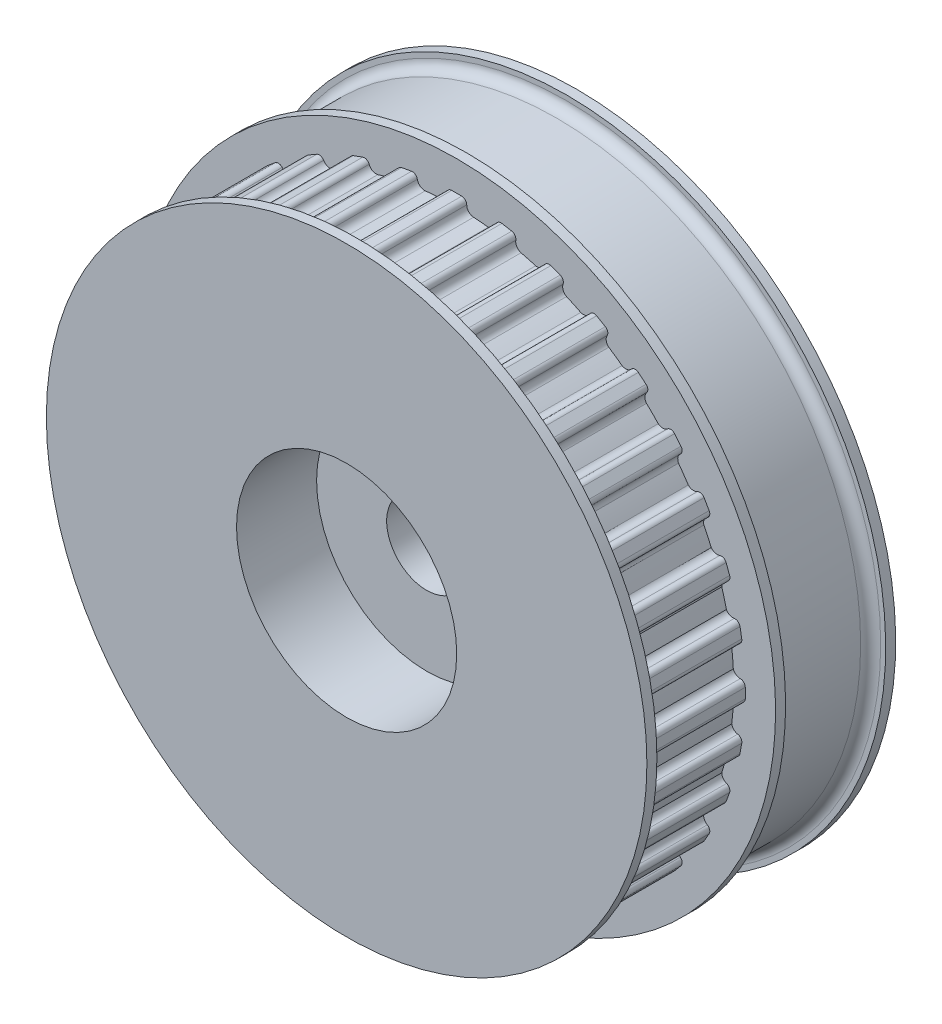
from build123d import *

# Parameters (mm, degrees)
ESQUISSE1_R                  = 27.675
BOSS_EXTRU_2_DEPTH           = 10
BOSS_EXTRU_3_DEPTH           = 10
R_P_TITION_CIRCULAIRE1_DEPTH = 10
CONG_1_R                     = 1
ESQUISSE6_R                  = 30
BOSS_EXTRU_4_DEPTH           = 1
ESQUISSE7_R                  = 11
ENL_V_MAT_EXTRU_1_DEPTH      = 8
ENL_V_START                  = -8
ESQUISSE8_R                  = 11
ENL_V_MAT_EXTRU_2_DEPTH      = 8
ESQUISSE9_R                  = 4
ENL_V_MAT_EXTRU_3_DEPTH      = 7


# Read off the part's stored shape, not the designer's step: Répétition circulaire1
with BuildPart() as part:
    # Esquisse1 → Boss.-Extru.2 (new body)
    with BuildSketch(Plane.XY):
        Circle(ESQUISSE1_R)
    extrude(amount=BOSS_EXTRU_2_DEPTH)

    # Esquisse1<6> → Boss.-Extru.3 (add)
    with BuildSketch(Plane.XY):
        with BuildLine():
            Line((0.5, 28.857678787), (-0.5, 28.857678787))
            ThreePointArc((-0.5, 28.857678787), (-0.853553391, 28.711232178), (-1, 28.357678787))
            ThreePointArc((-1, 28.357678787), (-1.203003238, 27.850200032), (-1.7, 27.622737464))
            ThreePointArc((-1.7, 27.622737464), (-18.958614467, -20.161263911), (27.675, 0))
            ThreePointArc((27.675, 0), (20.161263911, 18.958614467), (1.7, 27.622737464))
            ThreePointArc((1.7, 27.622737464), (1.203003238, 27.850200032), (1, 28.357678787))
            ThreePointArc((1, 28.357678787), (0.853553391, 28.711232178), (0.5, 28.857678787))
        make_face()
    extrude(amount=BOSS_EXTRU_3_DEPTH)

    # Répétition circulaire1 outline → Répétition circulaire1 (add)
    with BuildSketch(Plane.XY):
        with BuildLine():
            ThreePointArc((-6.424144978, 26.919063622), (-4.79229686, 27.256916843), (-3.143072504, 27.495940068))
            ThreePointArc((-3.143072504, 27.495940068), (-3.656689975, 27.644175319), (-3.934418407, 28.100950443))
            ThreePointArc((-3.934418407, 28.100950443), (-4.140034065, 28.423702376), (-4.513646372, 28.506530231))
            Line((-4.513646372, 28.506530231), (-5.498454125, 28.332882053))
            ThreePointArc((-5.498454125, 28.332882053), (-5.821206058, 28.127266395), (-5.904033913, 27.753654088))
            ThreePointArc((-5.904033913, 27.753654088), (-6.00419355, 27.236712828), (-6.424144978, 26.919063622))
        make_face()
        with BuildLine():
            ThreePointArc((3.143072504, 27.495940068), (4.79229686, 27.256916843), (6.424144978, 26.919063622))
            ThreePointArc((6.424144978, 26.919063622), (6.00419355, 27.236712828), (5.904033913, 27.753654088))
            ThreePointArc((5.904033913, 27.753654088), (5.821206058, 28.127266395), (5.498454125, 28.332882053))
            Line((5.498454125, 28.332882053), (4.513646372, 28.506530231))
            ThreePointArc((4.513646372, 28.506530231), (4.140034065, 28.423702376), (3.934418407, 28.100950443))
            ThreePointArc((3.934418407, 28.100950443), (3.656689975, 27.644175319), (3.143072504, 27.495940068))
        make_face()
        with BuildLine():
            ThreePointArc((7.889170476, 26.526715104), (9.448214121, 26.012244711), (10.974008576, 25.406234683))
            ThreePointArc((10.974008576, 25.406234683), (10.633039658, 25.792225092), (10.628676742, 26.307229328))
            ThreePointArc((10.628676742, 26.307229328), (10.611984326, 26.68954853), (10.329840504, 26.94808571))
            Line((10.329840504, 26.94808571), (9.390147883, 27.290105853))
            ThreePointArc((9.390147883, 27.290105853), (9.00782868, 27.273413436), (8.749291501, 26.991269614))
            ThreePointArc((8.749291501, 26.991269614), (8.407525978, 26.5955145), (7.889170476, 26.526715104))
        make_face()
        with BuildLine():
            ThreePointArc((12.393552552, 24.744807135), (13.817948437, 23.978530522), (15.195146723, 23.130351079))
            ThreePointArc((15.195146723, 23.130351079), (14.943029133, 23.566344587), (15.030372608, 24.062353393))
            ThreePointArc((15.030372608, 24.062353393), (15.080322819, 24.441762916), (14.847359906, 24.745366095))
            Line((14.847359906, 24.745366095), (13.981334502, 25.245366095))
            ThreePointArc((13.981334502, 25.245366095), (13.601924979, 25.295316306), (13.2983218, 25.062353393))
            ThreePointArc((13.2983218, 25.062353393), (12.904764441, 24.735966573), (12.393552552, 24.744807135))
        make_face()
        with BuildLine():
            ThreePointArc((16.518114838, 22.20489827), (17.7689566, 21.217205432), (18.960867241, 20.159145281))
            ThreePointArc((18.960867241, 20.159145281), (18.803320498, 20.625767223), (18.975378207, 21.087235702))
            ThreePointArc((18.975378207, 21.087235702), (19.090453335, 21.452207378), (18.91374979, 21.791651728))
            Line((18.91374979, 21.791651728), (18.147705347, 22.434439338))
            ThreePointArc((18.147705347, 22.434439338), (17.782733671, 22.549514465), (17.443289321, 22.372810921))
            ThreePointArc((17.443289321, 22.372810921), (17.01102193, 22.121796592), (16.518114838, 22.20489827))
        make_face()
        with BuildLine():
            ThreePointArc((20.136490878, 18.984924549), (21.18130249, 17.811739102), (22.157861101, 16.581158477))
            ThreePointArc((22.157861101, 16.581158477), (22.096502482, 17.058925341), (22.343826542, 17.4722737))
            ThreePointArc((22.343826542, 17.4722737), (22.520530086, 17.811718051), (22.405454958, 18.176689727))
            Line((22.405454958, 18.176689727), (21.762667349, 18.94273417))
            ThreePointArc((21.762667349, 18.94273417), (21.423222999, 19.119437714), (21.058251322, 19.004362587))
            ThreePointArc((21.058251322, 19.004362587), (20.600792937, 18.832378509), (20.136490878, 18.984924549))
        make_face()
        with BuildLine():
            ThreePointArc((23.137882669, 15.183675793), (23.951264035, 13.865156909), (24.689590487, 12.503189456))
            ThreePointArc((24.689590487, 12.503189456), (24.722179419, 12.973356653), (25.033369013, 13.32730618))
            ThreePointArc((25.033369013, 13.32730618), (25.266331926, 13.630909359), (25.216381715, 14.010318882))
            Line((25.216381715, 14.010318882), (24.716381715, 14.876344285))
            ThreePointArc((24.716381715, 14.876344285), (24.412778536, 15.109307199), (24.033369013, 15.059356987))
            ThreePointArc((24.033369013, 15.059356987), (23.564281023, 14.967766578), (23.137882669, 15.183675793))
        make_face()
        with BuildLine():
            ThreePointArc((25.430460102, 10.917752698), (25.99448608, 9.496963643), (26.479203261, 8.047199491))
            ThreePointArc((26.479203261, 8.047199491), (26.600052198, 8.492488796), (26.962285235, 8.77827588))
            ThreePointArc((26.962285235, 8.77827588), (27.244429057, 9.03681306), (27.261121474, 9.419132262))
            Line((27.261121474, 9.419132262), (26.91910133, 10.358824883))
            ThreePointArc((26.91910133, 10.358824883), (26.660564151, 10.640968705), (26.278244948, 10.657661122))
            ThreePointArc((26.278244948, 10.657661122), (25.810769805, 10.645646292), (25.430460102, 10.917752698))
        make_face()
        with BuildLine():
            ThreePointArc((26.944179758, 6.317974529), (27.248564404, 4.839562267), (27.471892269, 3.346753675))
            ThreePointArc((27.471892269, 3.346753675), (27.672401023, 3.751931091), (28.071966063, 3.963402786))
            ThreePointArc((28.071966063, 3.963402786), (28.394717997, 4.169018444), (28.477545851, 4.542630751))
            Line((28.477545851, 4.542630751), (28.303897673, 5.527438504))
            ThreePointArc((28.303897673, 5.527438504), (28.098282015, 5.850190438), (27.724669708, 5.933018292))
            ThreePointArc((27.724669708, 5.933018292), (27.271413498, 5.997742575), (26.944179758, 6.317974529))
        make_face()
        with BuildLine():
            ThreePointArc((27.632932139, 1.525347958), (27.674978781, 0.034270741), (27.636625152, -1.456906038))
            ThreePointArc((27.636625152, -1.456906038), (27.905891454, -1.104617248), (28.328694408, -0.971015621))
            ThreePointArc((28.328694408, -0.971015621), (28.682247799, -0.824569011), (28.828694408, -0.471015621))
            Line((28.828694408, -0.471015621), (28.828694408, 0.528984379))
            ThreePointArc((28.828694408, 0.528984379), (28.682247799, 0.88253777), (28.328694408, 1.028984379))
            ThreePointArc((28.328694408, 1.028984379), (27.901359078, 1.165793712), (27.632932139, 1.525347958))
        make_face()
        with BuildLine():
            ThreePointArc((27.475949667, -3.313278569), (27.260311872, -4.772946853), (26.967185059, -6.219047758))
            ThreePointArc((26.967185059, -6.219047758), (27.29264474, -5.929720179), (27.724669708, -5.875049533))
            ThreePointArc((27.724669708, -5.875049533), (28.098282015, -5.792221679), (28.303897673, -5.469469745))
            Line((28.303897673, -5.469469745), (28.477545851, -4.484661992))
            ThreePointArc((28.477545851, -4.484661992), (28.394717997, -4.111049685), (28.071966063, -3.905434027))
            ThreePointArc((28.071966063, -3.905434027), (27.681133515, -3.702785876), (27.475949667, -3.313278569))
        make_face()
        with BuildLine():
            ThreePointArc((26.478430923, -8.049740423), (26.016711192, -9.43590821), (25.482480602, -10.795777292))
            ThreePointArc((25.482480602, -10.795777292), (25.850535444, -10.576687654), (26.278244948, -10.599692363))
            ThreePointArc((26.278244948, -10.599692363), (26.660564151, -10.582999946), (26.91910133, -10.300856124))
            Line((26.91910133, -10.300856124), (27.261121474, -9.361163503))
            ThreePointArc((27.261121474, -9.361163503), (27.244429057, -8.978844301), (26.962285235, -8.720307121))
            ThreePointArc((26.962285235, -8.720307121), (26.617252193, -8.459420887), (26.478430923, -8.049740423))
        make_face()
        with BuildLine():
            ThreePointArc((24.671360923, -12.539121787), (23.981573714, -13.812666187), (23.22610391, -15.048379386))
            ThreePointArc((23.22610391, -15.048379386), (23.622702769, -14.904051397), (24.033369013, -15.001388228))
            ThreePointArc((24.033369013, -15.001388228), (24.412778536, -15.05133844), (24.716381715, -14.818375526))
            Line((24.716381715, -14.818375526), (25.216381715, -13.952350123))
            ThreePointArc((25.216381715, -13.952350123), (25.266331926, -13.5729406), (25.033369013, -13.269337421))
            ThreePointArc((25.033369013, -13.269337421), (24.742028624, -12.958929404), (24.671360923, -12.539121787))
        make_face()
        with BuildLine():
            ThreePointArc((22.11053237, -16.644217714), (21.216456316, -17.769851052), (20.265138012, -18.847541122))
            ThreePointArc((20.265138012, -18.847541122), (20.676286339, -18.779895826), (21.058251322, -18.946393828))
            ThreePointArc((21.058251322, -18.946393828), (21.423222999, -19.061468955), (21.762667349, -18.884765411))
            Line((21.762667349, -18.884765411), (22.405454958, -18.118720968))
            ThreePointArc((22.405454958, -18.118720968), (22.520530086, -17.753749292), (22.343826542, -17.414304941))
            ThreePointArc((22.343826542, -17.414304941), (22.112590254, -17.063975568), (22.11053237, -16.644217714))
        make_face()
        with BuildLine():
            ThreePointArc((18.874797938, -20.23975365), (17.805239611, -21.186766327), (16.688238468, -22.077325967))
            ThreePointArc((16.688238468, -22.077325967), (17.100421454, -22.085909599), (17.443289321, -22.314842162))
            ThreePointArc((17.443289321, -22.314842162), (17.782733671, -22.491545706), (18.147705347, -22.376470579))
            Line((18.147705347, -22.376470579), (18.91374979, -21.733682969))
            ThreePointArc((18.91374979, -21.733682969), (19.090453335, -21.394238619), (18.975378207, -21.029266943))
            ThreePointArc((18.975378207, -21.029266943), (18.809129828, -20.64928283), (18.874797938, -20.23975365))
        make_face()
        with BuildLine():
            ThreePointArc((15.063608203, -23.216229946), (13.851596836, -23.959108708), (12.603038059, -24.638771412))
            ThreePointArc((12.603038059, -24.638771412), (13.003552331, -24.721031), (13.2983218, -25.004384634))
            ThreePointArc((13.2983218, -25.004384634), (13.601924979, -25.237347547), (13.981334502, -25.187397336))
            Line((13.981334502, -25.187397336), (14.847359906, -24.687397336))
            ThreePointArc((14.847359906, -24.687397336), (15.080322819, -24.383794157), (15.030372608, -24.004384634))
            ThreePointArc((15.030372608, -24.004384634), (14.932445651, -23.605477067), (15.063608203, -23.216229946))
        make_face()
        with BuildLine():
            ThreePointArc((10.793912773, -25.483270435), (9.475842554, -26.002192848), (8.132946656, -26.452992339))
            ThreePointArc((8.132946656, -26.452992339), (8.510143799, -26.604572214), (8.749291501, -26.933300855))
            ThreePointArc((8.749291501, -26.933300855), (9.00782868, -27.215444677), (9.390147883, -27.232137094))
            Line((9.390147883, -27.232137094), (10.329840504, -26.890116951))
            ThreePointArc((10.329840504, -26.890116951), (10.611984326, -26.631579771), (10.628676742, -26.249260569))
            ThreePointArc((10.628676742, -26.249260569), (10.600846431, -25.842440074), (10.793912773, -25.483270435))
        make_face()
        with BuildLine():
            ThreePointArc((6.196522889, -26.972369734), (4.811256994, -27.253576483), (3.413439842, -27.463686086))
            ThreePointArc((3.413439842, -27.463686086), (3.756891384, -27.678723342), (3.934418407, -28.042981684))
            ThreePointArc((3.934418407, -28.042981684), (4.140034065, -28.365733617), (4.513646372, -28.448561472))
            Line((4.513646372, -28.448561472), (5.498454125, -28.274913294))
            ThreePointArc((5.498454125, -28.274913294), (5.821206058, -28.069297636), (5.904033913, -27.695685329))
            ThreePointArc((5.904033913, -27.695685329), (5.946516436, -27.29206904), (6.196522889, -26.972369734))
        make_face()
        with BuildLine():
            ThreePointArc((1.412051437, -27.638953232), (0, -27.675), (-1.412051437, -27.638953232))
            ThreePointArc((-1.412051437, -27.638953232), (-1.111453828, -27.910356098), (-1, -28.299710028))
            ThreePointArc((-1, -28.299710028), (-0.853553391, -28.653263419), (-0.5, -28.799710028))
            Line((-0.5, -28.799710028), (0.5, -28.799710028))
            ThreePointArc((0.5, -28.799710028), (0.853553391, -28.653263419), (1, -28.299710028))
            ThreePointArc((1, -28.299710028), (1.111453828, -27.910356098), (1.412051437, -27.638953232))
        make_face()
        with BuildLine():
            ThreePointArc((-3.413439842, -27.463686086), (-4.811256994, -27.253576483), (-6.196522889, -26.972369734))
            ThreePointArc((-6.196522889, -26.972369734), (-5.946516436, -27.29206904), (-5.904033913, -27.695685329))
            ThreePointArc((-5.904033913, -27.695685329), (-5.821206058, -28.069297636), (-5.498454125, -28.274913294))
            Line((-5.498454125, -28.274913294), (-4.513646372, -28.448561472))
            ThreePointArc((-4.513646372, -28.448561472), (-4.140034065, -28.365733617), (-3.934418407, -28.042981684))
            ThreePointArc((-3.934418407, -28.042981684), (-3.756891384, -27.678723342), (-3.413439842, -27.463686086))
        make_face()
        with BuildLine():
            ThreePointArc((-8.132946656, -26.452992339), (-9.475842554, -26.002192848), (-10.793912773, -25.483270435))
            ThreePointArc((-10.793912773, -25.483270435), (-10.600846431, -25.842440074), (-10.628676742, -26.249260569))
            ThreePointArc((-10.628676742, -26.249260569), (-10.611984326, -26.631579771), (-10.329840504, -26.890116951))
            Line((-10.329840504, -26.890116951), (-9.390147883, -27.232137094))
            ThreePointArc((-9.390147883, -27.232137094), (-9.00782868, -27.215444677), (-8.749291501, -26.933300855))
            ThreePointArc((-8.749291501, -26.933300855), (-8.510143799, -26.604572214), (-8.132946656, -26.452992339))
        make_face()
        with BuildLine():
            ThreePointArc((-12.603038059, -24.638771412), (-13.851596836, -23.959108708), (-15.063608203, -23.216229946))
            ThreePointArc((-15.063608203, -23.216229946), (-14.932445651, -23.605477067), (-15.030372608, -24.004384634))
            ThreePointArc((-15.030372608, -24.004384634), (-15.080322819, -24.383794157), (-14.847359906, -24.687397336))
            Line((-14.847359906, -24.687397336), (-13.981334502, -25.187397336))
            ThreePointArc((-13.981334502, -25.187397336), (-13.601924979, -25.237347547), (-13.2983218, -25.004384634))
            ThreePointArc((-13.2983218, -25.004384634), (-13.003552331, -24.721031), (-12.603038059, -24.638771412))
        make_face()
        with BuildLine():
            ThreePointArc((-16.688238468, -22.077325967), (-17.805239611, -21.186766327), (-18.874797938, -20.23975365))
            ThreePointArc((-18.874797938, -20.23975365), (-18.809129828, -20.64928283), (-18.975378207, -21.029266943))
            ThreePointArc((-18.975378207, -21.029266943), (-19.090453335, -21.394238619), (-18.91374979, -21.733682969))
            Line((-18.91374979, -21.733682969), (-18.147705347, -22.376470579))
            ThreePointArc((-18.147705347, -22.376470579), (-17.782733671, -22.491545706), (-17.443289321, -22.314842162))
            ThreePointArc((-17.443289321, -22.314842162), (-17.100421454, -22.085909599), (-16.688238468, -22.077325967))
        make_face()
        with BuildLine():
            ThreePointArc((-20.265138012, -18.847541122), (-21.216456316, -17.769851052), (-22.11053237, -16.644217714))
            ThreePointArc((-22.11053237, -16.644217714), (-22.112590254, -17.063975568), (-22.343826542, -17.414304941))
            ThreePointArc((-22.343826542, -17.414304941), (-22.520530086, -17.753749292), (-22.405454958, -18.118720968))
            Line((-22.405454958, -18.118720968), (-21.762667349, -18.884765411))
            ThreePointArc((-21.762667349, -18.884765411), (-21.423222999, -19.061468955), (-21.058251322, -18.946393828))
            ThreePointArc((-21.058251322, -18.946393828), (-20.676286339, -18.779895826), (-20.265138012, -18.847541122))
        make_face()
        with BuildLine():
            ThreePointArc((-23.22610391, -15.048379386), (-23.981573714, -13.812666187), (-24.671360923, -12.539121787))
            ThreePointArc((-24.671360923, -12.539121787), (-24.742028624, -12.958929404), (-25.033369013, -13.269337421))
            ThreePointArc((-25.033369013, -13.269337421), (-25.266331926, -13.5729406), (-25.216381715, -13.952350123))
            Line((-25.216381715, -13.952350123), (-24.716381715, -14.818375526))
            ThreePointArc((-24.716381715, -14.818375526), (-24.412778536, -15.05133844), (-24.033369013, -15.001388228))
            ThreePointArc((-24.033369013, -15.001388228), (-23.622702769, -14.904051397), (-23.22610391, -15.048379386))
        make_face()
        with BuildLine():
            ThreePointArc((-25.482480602, -10.795777292), (-26.016711192, -9.43590821), (-26.478430923, -8.049740423))
            ThreePointArc((-26.478430923, -8.049740423), (-26.617252193, -8.459420887), (-26.962285235, -8.720307121))
            ThreePointArc((-26.962285235, -8.720307121), (-27.244429057, -8.978844301), (-27.261121474, -9.361163503))
            Line((-27.261121474, -9.361163503), (-26.91910133, -10.300856124))
            ThreePointArc((-26.91910133, -10.300856124), (-26.660564151, -10.582999946), (-26.278244948, -10.599692363))
            ThreePointArc((-26.278244948, -10.599692363), (-25.850535444, -10.576687654), (-25.482480602, -10.795777292))
        make_face()
        with BuildLine():
            ThreePointArc((-26.967185059, -6.219047758), (-27.260311872, -4.772946853), (-27.475949667, -3.313278569))
            ThreePointArc((-27.475949667, -3.313278569), (-27.681133515, -3.702785876), (-28.071966063, -3.905434027))
            ThreePointArc((-28.071966063, -3.905434027), (-28.394717997, -4.111049685), (-28.477545851, -4.484661992))
            Line((-28.477545851, -4.484661992), (-28.303897673, -5.469469745))
            ThreePointArc((-28.303897673, -5.469469745), (-28.098282015, -5.792221679), (-27.724669708, -5.875049533))
            ThreePointArc((-27.724669708, -5.875049533), (-27.29264474, -5.929720179), (-26.967185059, -6.219047758))
        make_face()
        with BuildLine():
            ThreePointArc((-27.636625152, -1.456906038), (-27.674978781, 0.034270741), (-27.632932139, 1.525347958))
            ThreePointArc((-27.632932139, 1.525347958), (-27.901359078, 1.165793712), (-28.328694408, 1.028984379))
            ThreePointArc((-28.328694408, 1.028984379), (-28.682247799, 0.88253777), (-28.828694408, 0.528984379))
            Line((-28.828694408, 0.528984379), (-28.828694408, -0.471015621))
            ThreePointArc((-28.828694408, -0.471015621), (-28.682247799, -0.824569011), (-28.328694408, -0.971015621))
            ThreePointArc((-28.328694408, -0.971015621), (-27.905891454, -1.104617248), (-27.636625152, -1.456906038))
        make_face()
        with BuildLine():
            ThreePointArc((-27.471892269, 3.346753675), (-27.248564404, 4.839562267), (-26.944179758, 6.317974529))
            ThreePointArc((-26.944179758, 6.317974529), (-27.271413498, 5.997742575), (-27.724669708, 5.933018292))
            ThreePointArc((-27.724669708, 5.933018292), (-28.098282015, 5.850190438), (-28.303897673, 5.527438504))
            Line((-28.303897673, 5.527438504), (-28.477545851, 4.542630751))
            ThreePointArc((-28.477545851, 4.542630751), (-28.394717997, 4.169018444), (-28.071966063, 3.963402786))
            ThreePointArc((-28.071966063, 3.963402786), (-27.672401023, 3.751931091), (-27.471892269, 3.346753675))
        make_face()
        with BuildLine():
            ThreePointArc((-26.479203261, 8.047199491), (-25.99448608, 9.496963643), (-25.430460102, 10.917752698))
            ThreePointArc((-25.430460102, 10.917752698), (-25.810769805, 10.645646292), (-26.278244948, 10.657661122))
            ThreePointArc((-26.278244948, 10.657661122), (-26.660564151, 10.640968705), (-26.91910133, 10.358824883))
            Line((-26.91910133, 10.358824883), (-27.261121474, 9.419132262))
            ThreePointArc((-27.261121474, 9.419132262), (-27.244429057, 9.03681306), (-26.962285235, 8.77827588))
            ThreePointArc((-26.962285235, 8.77827588), (-26.600052198, 8.492488796), (-26.479203261, 8.047199491))
        make_face()
        with BuildLine():
            ThreePointArc((-24.689590487, 12.503189456), (-23.951264035, 13.865156909), (-23.137882669, 15.183675793))
            ThreePointArc((-23.137882669, 15.183675793), (-23.564281023, 14.967766578), (-24.033369013, 15.059356987))
            ThreePointArc((-24.033369013, 15.059356987), (-24.412778536, 15.109307199), (-24.716381715, 14.876344285))
            Line((-24.716381715, 14.876344285), (-25.216381715, 14.010318882))
            ThreePointArc((-25.216381715, 14.010318882), (-25.266331926, 13.630909359), (-25.033369013, 13.32730618))
            ThreePointArc((-25.033369013, 13.32730618), (-24.722179419, 12.973356653), (-24.689590487, 12.503189456))
        make_face()
        with BuildLine():
            ThreePointArc((-22.157861101, 16.581158477), (-21.18130249, 17.811739102), (-20.136490878, 18.984924549))
            ThreePointArc((-20.136490878, 18.984924549), (-20.600792937, 18.832378509), (-21.058251322, 19.004362587))
            ThreePointArc((-21.058251322, 19.004362587), (-21.423222999, 19.119437714), (-21.762667349, 18.94273417))
            Line((-21.762667349, 18.94273417), (-22.405454958, 18.176689727))
            ThreePointArc((-22.405454958, 18.176689727), (-22.520530086, 17.811718051), (-22.343826542, 17.4722737))
            ThreePointArc((-22.343826542, 17.4722737), (-22.096502482, 17.058925341), (-22.157861101, 16.581158477))
        make_face()
        with BuildLine():
            ThreePointArc((-18.960867241, 20.159145281), (-17.7689566, 21.217205432), (-16.518114838, 22.20489827))
            ThreePointArc((-16.518114838, 22.20489827), (-17.01102193, 22.121796592), (-17.443289321, 22.372810921))
            ThreePointArc((-17.443289321, 22.372810921), (-17.782733671, 22.549514465), (-18.147705347, 22.434439338))
            Line((-18.147705347, 22.434439338), (-18.91374979, 21.791651728))
            ThreePointArc((-18.91374979, 21.791651728), (-19.090453335, 21.452207378), (-18.975378207, 21.087235702))
            ThreePointArc((-18.975378207, 21.087235702), (-18.803320498, 20.625767223), (-18.960867241, 20.159145281))
        make_face()
        with BuildLine():
            ThreePointArc((-15.195146723, 23.130351079), (-13.817948437, 23.978530522), (-12.393552552, 24.744807135))
            ThreePointArc((-12.393552552, 24.744807135), (-12.904764441, 24.735966573), (-13.2983218, 25.062353393))
            ThreePointArc((-13.2983218, 25.062353393), (-13.601924979, 25.295316306), (-13.981334502, 25.245366095))
            Line((-13.981334502, 25.245366095), (-14.847359906, 24.745366095))
            ThreePointArc((-14.847359906, 24.745366095), (-15.080322819, 24.441762916), (-15.030372608, 24.062353393))
            ThreePointArc((-15.030372608, 24.062353393), (-14.943029133, 23.566344587), (-15.195146723, 23.130351079))
        make_face()
        with BuildLine():
            ThreePointArc((-10.974008576, 25.406234683), (-9.448214121, 26.012244711), (-7.889170476, 26.526715104))
            ThreePointArc((-7.889170476, 26.526715104), (-8.407525978, 26.5955145), (-8.749291501, 26.991269614))
            ThreePointArc((-8.749291501, 26.991269614), (-9.00782868, 27.273413436), (-9.390147883, 27.290105853))
            Line((-9.390147883, 27.290105853), (-10.329840504, 26.94808571))
            ThreePointArc((-10.329840504, 26.94808571), (-10.611984326, 26.68954853), (-10.628676742, 26.307229328))
            ThreePointArc((-10.628676742, 26.307229328), (-10.633039658, 25.792225092), (-10.974008576, 25.406234683))
        make_face()
    extrude(amount=R_P_TITION_CIRCULAIRE1_DEPTH)

    # Esquisse4 → Révolution1 (revolve)
    with BuildSketch(Plane(origin=(0, 0, 0), x_dir=(0, 0, -1), z_dir=(1, 0, 0))):
        Polygon((0, 28.857678787), (0, 31.857678787), (1, 31.857678787), (1, 30.357678787), (11, 30.357678787), (11, 31.857678787), (12, 31.857678787), (12, 0), (0, 0), align=None)
    revolve(axis=Axis((0, 0, -12), (0, 0, 1)))

    # Congé1
    cong_1_edges = [part.edges().sort_by_distance(p)[0] for p in [
        (0, -30.357678787, -1),
        (0, -30.357678787, -11),
    ]]
    fillet(cong_1_edges, radius=CONG_1_R)

    # Esquisse6 → Boss.-Extru.4 (add)
    with BuildSketch(Plane.XY.offset(10)):
        Circle(ESQUISSE6_R)
    extrude(amount=BOSS_EXTRU_4_DEPTH)

    # Esquisse7 → Enlèv. mat.-Extru.1 (cut)
    with BuildSketch(Plane(origin=(0, 0, -12), x_dir=(-1, 0, 0), z_dir=(0, 0, -1))):
        with Locations(Location((0, 0, 0), (0, 0, 90))):
            Circle(ESQUISSE7_R)
    extrude(amount=-ENL_V_MAT_EXTRU_1_DEPTH, mode=Mode.SUBTRACT)

    # Esquisse8 → Enlèv. mat.-Extru.2 (cut)
    with BuildSketch(Plane.XY.offset(11).offset(ENL_V_START)):
        with Locations(Location((0, 0, 0), (0, 0, 90))):
            Circle(ESQUISSE8_R)
    extrude(amount=ENL_V_MAT_EXTRU_2_DEPTH, mode=Mode.SUBTRACT)

    # Esquisse9 → Enlèv. mat.-Extru.3 (cut)
    with BuildSketch(Plane.XY.offset(3)):
        Circle(ESQUISSE9_R)
    extrude(amount=-ENL_V_MAT_EXTRU_3_DEPTH, mode=Mode.SUBTRACT)


solid = part.part
